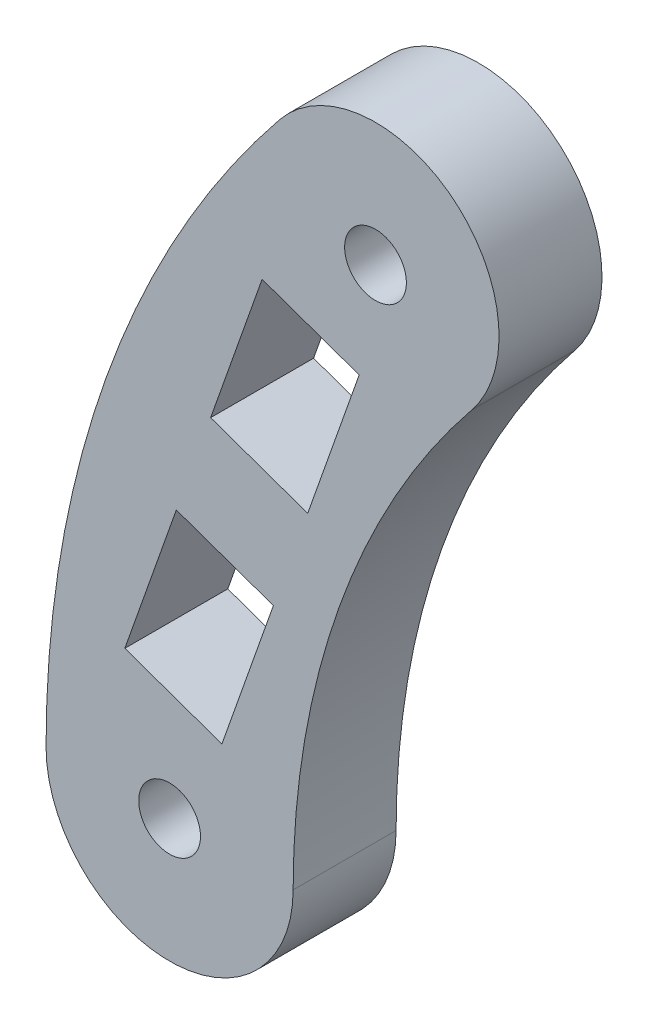
from build123d import *

# Parameters (mm, degrees)
ESQUISSE1_R        = 1.5
BOSS_EXTRU_1_DEPTH = 5


with BuildPart() as part:
    # Esquisse1 → Boss.-Extru.1 (new body)
    with BuildSketch(Plane.XY):
        with BuildLine():
            ThreePointArc((-39.666666667, 32.055507414), (-48.083261121, 17), (-51, 0))
            ThreePointArc((-51, 0), (-45, -6), (-39, 0))
            ThreePointArc((-39, 0), (-36.769552622, 13), (-30.333333333, 24.513035081))
            ThreePointArc((-30.333333333, 24.513035081), (-31.228763834, 32.950937914), (-39.666666667, 32.055507414))
        make_face()
        with Locations((-35, 28.284271247)):
            Circle(ESQUISSE1_R, mode=Mode.SUBTRACT)
        with Locations((-45, 0)):
            Circle(ESQUISSE1_R, mode=Mode.SUBTRACT)
        Polygon((-35.793241892, 23.261423749), (-38.293241892, 16.190355937), (-43.0072871, 17.857022604), (-40.5072871, 24.928090416), align=None, mode=Mode.SUBTRACT)
        Polygon((-47.173953767, 6.071909584), (-42.459908559, 4.405242918), (-39.959908559, 11.476310729), (-44.673953767, 13.142977396), align=None, mode=Mode.SUBTRACT)
    extrude(amount=BOSS_EXTRU_1_DEPTH)


solid = part.part
